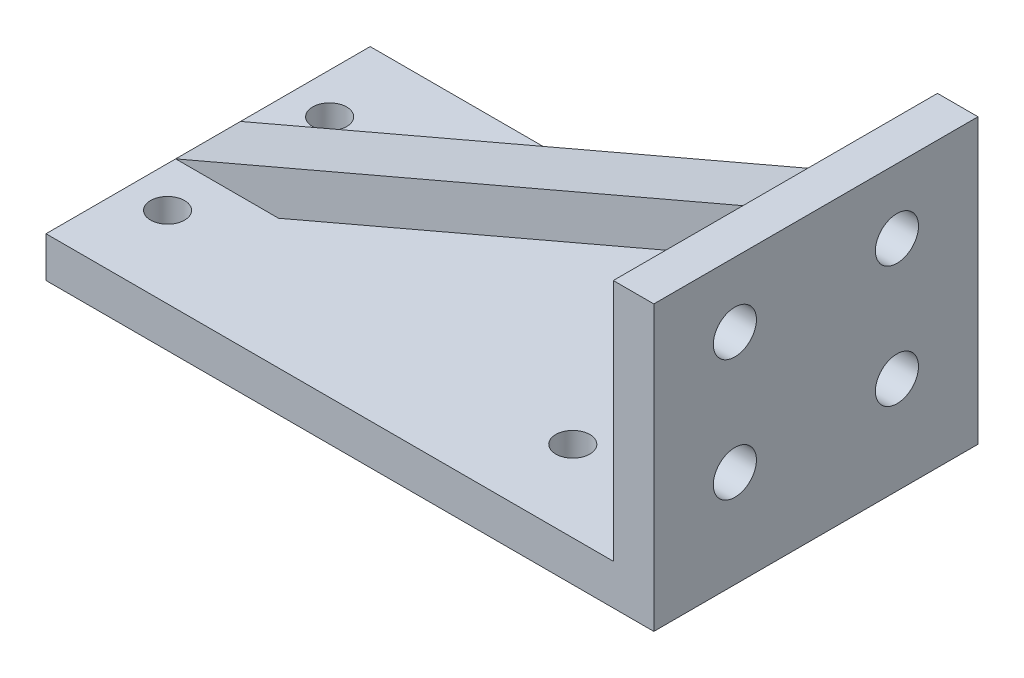
from build123d import *

# Parameters (mm, degrees)
BOSS_EXTRUDE1_DEPTH = 50.8
SKETCH4_R           = 2.667
CUT_EXTRUDE1_DEPTH  = 117.743329574
SKETCH5_W           = 88.9
SKETCH5_H           = 38.1
CUT_EXTRUDE2_DEPTH  = 20.32
SKETCH6_W           = 88.9
SKETCH6_H           = 38.1
CUT_EXTRUDE3_DEPTH  = 20.32
SKETCH7_R           = 3.3782
CUT_EXTRUDE4_DEPTH  = 117.743329574


with BuildPart() as part:
    # Sketch3 → Boss-Extrude1 (new body)
    with BuildSketch(Plane.XY):
        Polygon((88.9, 44.45), (0, 6.35), (0, 0), (88.9, 0), (95.25, 0), (95.25, 6.35), (95.25, 44.45), align=None)
        Polygon((88.9, 6.35), (16.120053074, 6.35), (88.9, 37.541405825), align=None, mode=Mode.SUBTRACT)
    extrude(amount=BOSS_EXTRUDE1_DEPTH)

    # Sketch4 → Cut-Extrude1 (cut, through all)
    with BuildSketch(Plane.XZ):
        with Locations((6.35, 38.1)):
            Circle(SKETCH4_R)
        with Locations((6.35, 12.7)):
            Circle(SKETCH4_R)
        with Locations((69.85, 12.7)):
            Circle(SKETCH4_R)
        with Locations((69.85, 38.1)):
            Circle(SKETCH4_R)
    extrude(amount=-CUT_EXTRUDE1_DEPTH, mode=Mode.SUBTRACT)

    # Sketch5 → Cut-Extrude2 (cut)
    with BuildSketch(Plane.XY.offset(50.8)):
        with Locations((44.45, 25.4)):
            Rectangle(SKETCH5_W, SKETCH5_H)
    extrude(amount=-CUT_EXTRUDE2_DEPTH, mode=Mode.SUBTRACT)

    # Sketch6 → Cut-Extrude3 (cut)
    with BuildSketch(Plane(origin=(0, 0, 0), x_dir=(-1, 0, 0), z_dir=(0, 0, -1))):
        with Locations((-44.45, 25.4)):
            Rectangle(SKETCH6_W, SKETCH6_H)
    extrude(amount=-CUT_EXTRUDE3_DEPTH, mode=Mode.SUBTRACT)

    # Sketch7 → Cut-Extrude4 (cut, through all)
    with BuildSketch(Plane(origin=(95.25, 0, 0), x_dir=(0, 0, -1), z_dir=(1, 0, 0))):
        with Locations((-38.1, 15.24)):
            Circle(SKETCH7_R)
        with Locations((-12.7, 15.24)):
            Circle(SKETCH7_R)
        with Locations((-12.7, 34.29)):
            Circle(SKETCH7_R)
        with Locations((-38.1, 34.29)):
            Circle(SKETCH7_R)
    extrude(amount=-CUT_EXTRUDE4_DEPTH, mode=Mode.SUBTRACT)


solid = part.part
